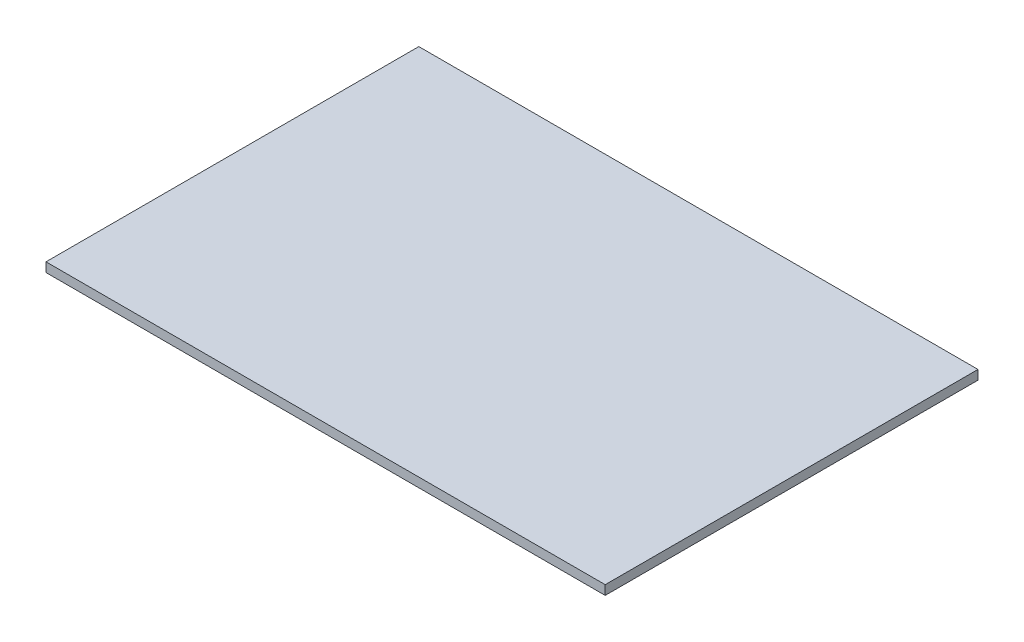
from build123d import *

# Parameters (mm, degrees)
SKETCH1_W                 = 600
SKETCH1_H                 = 400
BOSS_EXTRUDE1_DEPTH       = 10
BODY_MOVE_COPY1_START     = -300
BODY_MOVE_COPY1_OUTLINE_W = 10
BODY_MOVE_COPY1_OUTLINE_H = 400
BODY_MOVE_COPY1_DEPTH     = 600


# Read off the part's stored shape, not the designer's step: Body-Move/Copy1
with BuildPart() as part:
    # Sketch1 → Boss-Extrude1 (new body)
    with BuildSketch(Plane(origin=(0, 0, 0), x_dir=(1, 0, 0), z_dir=(0, 1, 0))):
        Rectangle(SKETCH1_W, SKETCH1_H)
    extrude(amount=-BOSS_EXTRUDE1_DEPTH)


with BuildPart() as body_2:
    # Body-Move/Copy1 outline → Body-Move/Copy1 (new body)
    with BuildSketch(Plane.YZ.offset(BODY_MOVE_COPY1_START)):
        with Locations((-5, 0)):
            Rectangle(BODY_MOVE_COPY1_OUTLINE_W, BODY_MOVE_COPY1_OUTLINE_H)
    extrude(amount=BODY_MOVE_COPY1_DEPTH)


solid = Compound([part.part, body_2.part])
